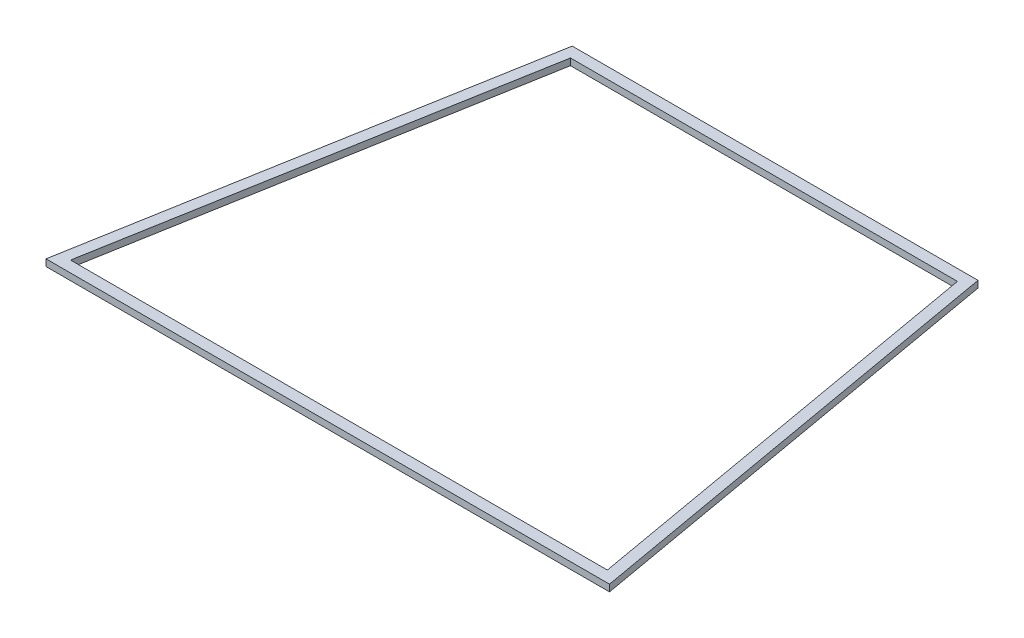
from build123d import *

# Parameters (mm, degrees)
EXTRUDE_THIN1_DEPTH = 3


with BuildPart() as part:
    # Sketch1 → Extrude-Thin1 (new body)
    with BuildSketch(Plane(origin=(0, 0, 0), x_dir=(1, 0, 0), z_dir=(0, 1, 0))):
        Polygon((245.958767963, -5), (-5.958767963, -5), (29.306628179, 195), (210.693371821, 195), align=None)
        Polygon((240, 0), (0, 0), (33.502126335, 190), (206.497873665, 190), align=None, mode=Mode.SUBTRACT)
    extrude(amount=EXTRUDE_THIN1_DEPTH)


solid = part.part
